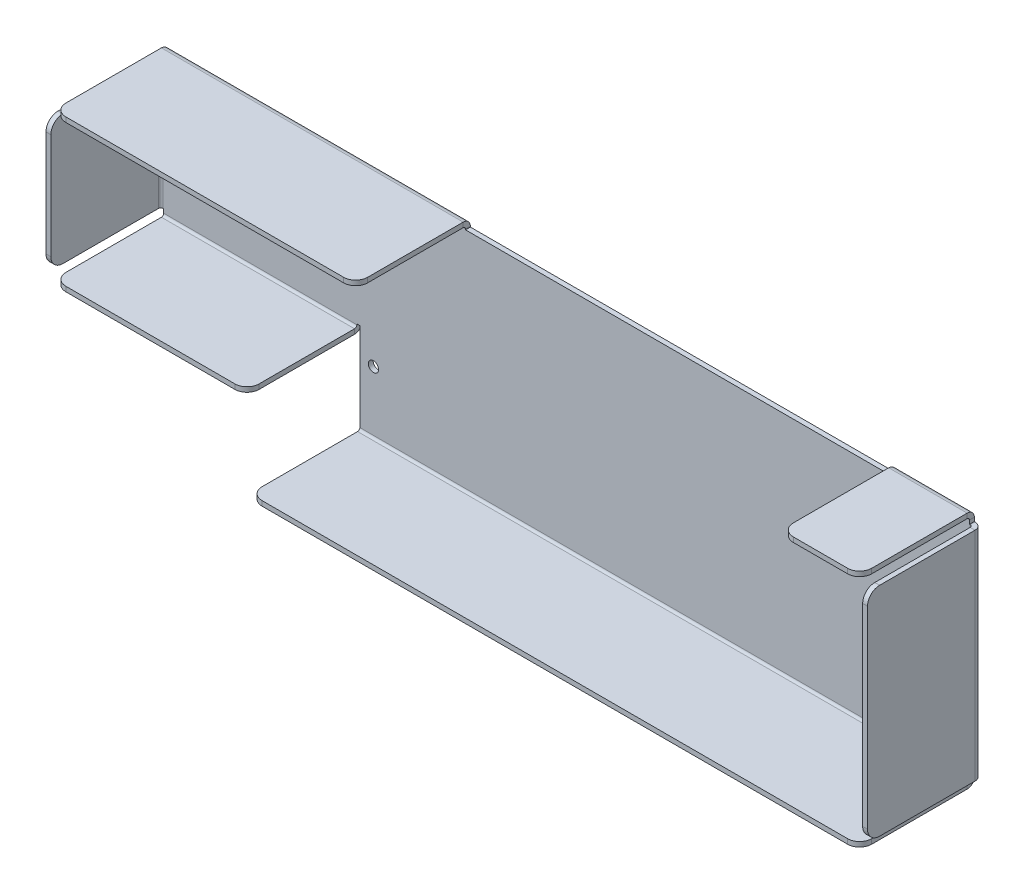
from build123d import *

# Parameters (mm, degrees)
SKETCH1_W              = 202
SKETCH1_H              = 74
BOSS_EXTRUDE1_DEPTH    = 1.6002
M3_CLEARANCE_HOLE1_D   = 3.4
SKETCH3_W              = 202
SKETCH3_H              = 2.5875
BOSS_EXTRUDE2_DEPTH    = 38
SKETCH6_W              = 35
SKETCH6_H              = 2.5875
SKETCH6_W_2            = 26
BOSS_EXTRUDE3_DEPTH    = 38
SKETCH7_W              = 2.5875
SKETCH7_H              = 72
BOSS_EXTRUDE4_DEPTH    = 38
SKETCH8_W              = 65
SKETCH8_H              = 45
BOSS_EXTRUDE5_DEPTH    = 1.6002
SKETCH9_W              = 65
SKETCH9_H              = 38
BOSS_EXTRUDE6_DEPTH    = 2.5875
SKETCH10_W             = 2.5875
SKETCH10_H             = 43
SKETCH10_W_2           = 64
SKETCH10_H_2           = 2.5875
BOSS_EXTRUDE7_DEPTH    = 38
CUT_EXTRUDE1_DEPTH     = 36.3998
CONVERT_SOLID1_START   = -101
CONVERT_SOLID1_DEPTH   = 202
CONVERT_SOLID1_START_2 = -166
CONVERT_SOLID1_2_DEPTH = 64
CONVERT_SOLID1_START_3 = -102
CONVERT_SOLID1_3_DEPTH = 36
CONVERT_SOLID1_START_4 = 75
CONVERT_SOLID1_4_DEPTH = 26
CONVERT_SOLID1_START_5 = -7
CONVERT_SOLID1_5_DEPTH = 43
CONVERT_SOLID1_START_6 = -36
CONVERT_SOLID1_6_DEPTH = 29
CONVERT_SOLID1_7_DEPTH = 267
CONVERT_SOLID1_8_DEPTH = 64
CONVERT_SOLID1_9_DEPTH = 72
FILLET1_R              = 4


# Read off the part's stored shape, not the designer's step: Convert-Solid1
with BuildPart() as part:
    # Sketch1 → Boss-Extrude1 (new body)
    with BuildSketch(Plane.XY):
        Rectangle(SKETCH1_W, SKETCH1_H)
    extrude(amount=BOSS_EXTRUDE1_DEPTH)

    # M3 Clearance Hole1 (through all)
    with Locations(Plane.XY.offset(1.6002)):
        with Locations((-96.5, 17.5), (95.5, -17.5), (-96.5, -17.5), (95.5, 17.5)):
            Hole(M3_CLEARANCE_HOLE1_D / 2)

    # Sketch3 → Boss-Extrude2 (add)
    with BuildSketch(Plane.XY):
        with Locations((0, -38.29375)):
            Rectangle(SKETCH3_W, SKETCH3_H)
    extrude(amount=BOSS_EXTRUDE2_DEPTH)

    # Sketch6 → Boss-Extrude3 (add)
    with BuildSketch(Plane.XY):
        with Locations((-83.5, 38.29375)):
            Rectangle(SKETCH6_W, SKETCH6_H)
        with Locations((88, 38.29375)):
            Rectangle(SKETCH6_W_2, SKETCH6_H)
    extrude(amount=BOSS_EXTRUDE3_DEPTH)

    # Sketch7 → Boss-Extrude4 (add)
    with BuildSketch(Plane.XY):
        with Locations((102.29375, 0)):
            Rectangle(SKETCH7_W, SKETCH7_H)
    extrude(amount=BOSS_EXTRUDE4_DEPTH)

    # Sketch8 → Boss-Extrude5 (add)
    with BuildSketch(Plane.XY):
        with Locations((-133.5, 14.5)):
            Rectangle(SKETCH8_W, SKETCH8_H)
    extrude(amount=BOSS_EXTRUDE5_DEPTH)

    # Sketch9 → Boss-Extrude6 (add)
    with BuildSketch(Plane(origin=(0, 37, 0), x_dir=(1, 0, 0), z_dir=(0, 1, 0))):
        with Locations((-133.5, -19)):
            Rectangle(SKETCH9_W, SKETCH9_H)
    extrude(amount=BOSS_EXTRUDE6_DEPTH)

    # Sketch10 → Boss-Extrude7 (add)
    with BuildSketch(Plane.XY):
        with Locations((-167.29375, 14.5)):
            Rectangle(SKETCH10_W, SKETCH10_H)
        with Locations((-134, -9.29375)):
            Rectangle(SKETCH10_W_2, SKETCH10_H_2)
    extrude(amount=BOSS_EXTRUDE7_DEPTH)

    # Sketch15 → Cut-Extrude1 (cut)
    with BuildSketch(Plane.XY.offset(38)):
        Polygon((102, 38), (-167, 38), (-167, -9), (-102, -9), (-102, -38), (102, -38), align=None)
    extrude(amount=-CUT_EXTRUDE1_DEPTH, mode=Mode.SUBTRACT)

    # Convert-Solid1 outline → Convert-Solid1 (add)
    with BuildSketch(Plane.YZ.offset(CONVERT_SOLID1_START)):
        with BuildLine():
            Line((-38, 1.6002), (-37.238, 1.6002))
            ThreePointArc((-37.238, 1.6002), (-37.776815367, 1.823384633), (-38, 2.3622))
            Line((-38, 2.3622), (-38, 1.6002))
        make_face()
        with BuildLine():
            Line((-39.5875, 2.117580723), (-39.5875, 38))
            Line((-39.5875, 38), (-39.6002, 38))
            Line((-39.6002, 38), (-39.6002, 2.3622))
            ThreePointArc((-39.6002, 2.3622), (-39.597022863, 2.239725635), (-39.5875, 2.117580723))
        make_face()
    extrude(amount=CONVERT_SOLID1_DEPTH)

    # Convert-Solid1 2 outline → Convert-Solid1 2 (add)
    with BuildSketch(Plane.YZ.offset(CONVERT_SOLID1_START_2)):
        with BuildLine():
            ThreePointArc((-10.6002, 2.3622), (-10.597022863, 2.239725635), (-10.5875, 2.117580723))
            Line((-10.5875, 2.117580723), (-10.5875, 38))
            Line((-10.5875, 38), (-10.6002, 38))
            Line((-10.6002, 38), (-10.6002, 2.3622))
        make_face()
        with BuildLine():
            Line((-9, 2.3622), (-9, 1.6002))
            Line((-9, 1.6002), (-8.238, 1.6002))
            ThreePointArc((-8.238, 1.6002), (-8.776815367, 1.823384633), (-9, 2.3622))
        make_face()
        with BuildLine():
            ThreePointArc((38, 2.3622), (37.776815367, 1.823384633), (37.238, 1.6002))
            Line((37.238, 1.6002), (38, 1.6002))
            Line((38, 1.6002), (38, 2.3622))
        make_face()
        with BuildLine():
            Line((39.5875, 38), (39.5875, 2.117580723))
            ThreePointArc((39.5875, 2.117580723), (39.597022863, 2.239725635), (39.6002, 2.3622))
            Line((39.6002, 2.3622), (39.6002, 38))
            Line((39.6002, 38), (39.5875, 38))
        make_face()
    extrude(amount=CONVERT_SOLID1_2_DEPTH)

    # Convert-Solid1 3 outline → Convert-Solid1 3 (add)
    with BuildSketch(Plane.YZ.offset(CONVERT_SOLID1_START_3)):
        with BuildLine():
            ThreePointArc((38, 2.3622), (37.776815367, 1.823384633), (37.238, 1.6002))
            Line((37.238, 1.6002), (38, 1.6002))
            Line((38, 1.6002), (38, 2.3622))
        make_face()
        with BuildLine():
            Line((39.5875, 38), (39.5875, 2.117580723))
            ThreePointArc((39.5875, 2.117580723), (39.597022863, 2.239725635), (39.6002, 2.3622))
            Line((39.6002, 2.3622), (39.6002, 38))
            Line((39.6002, 38), (39.5875, 38))
        make_face()
    extrude(amount=CONVERT_SOLID1_3_DEPTH)

    # Convert-Solid1 4 outline → Convert-Solid1 4 (add)
    with BuildSketch(Plane.YZ.offset(CONVERT_SOLID1_START_4)):
        with BuildLine():
            ThreePointArc((38, 2.3622), (37.776815367, 1.823384633), (37.238, 1.6002))
            Line((37.238, 1.6002), (38, 1.6002))
            Line((38, 1.6002), (38, 2.3622))
        make_face()
        with BuildLine():
            Line((39.5875, 38), (39.5875, 2.117580723))
            ThreePointArc((39.5875, 2.117580723), (39.597022863, 2.239725635), (39.6002, 2.3622))
            Line((39.6002, 2.3622), (39.6002, 38))
            Line((39.6002, 38), (39.5875, 38))
        make_face()
    extrude(amount=CONVERT_SOLID1_4_DEPTH)

    # Convert-Solid1 5 outline → Convert-Solid1 5 (add)
    with BuildSketch(Plane(origin=(0, 0, 0), x_dir=(1, 0, 0), z_dir=(0, 1, 0)).offset(CONVERT_SOLID1_START_5)):
        with BuildLine():
            ThreePointArc((-167, -2.3622), (-166.776815367, -1.823384633), (-166.238, -1.6002))
            Line((-166.238, -1.6002), (-167, -1.6002))
            Line((-167, -1.6002), (-167, -2.3622))
        make_face()
        with BuildLine():
            Line((102, -1.6002), (101.238, -1.6002))
            ThreePointArc((101.238, -1.6002), (101.776815367, -1.823384633), (102, -2.3622))
            Line((102, -2.3622), (102, -1.6002))
        make_face()
        with BuildLine():
            Line((-168.6002, -38), (-168.5875, -38))
            Line((-168.5875, -38), (-168.5875, -2.117580723))
            ThreePointArc((-168.5875, -2.117580723), (-168.597022863, -2.239725635), (-168.6002, -2.3622))
            Line((-168.6002, -2.3622), (-168.6002, -38))
        make_face()
        with BuildLine():
            Line((103.5875, -2.117580723), (103.5875, -38))
            Line((103.5875, -38), (103.6002, -38))
            Line((103.6002, -38), (103.6002, -2.3622))
            ThreePointArc((103.6002, -2.3622), (103.597022863, -2.239725635), (103.5875, -2.117580723))
        make_face()
    extrude(amount=CONVERT_SOLID1_5_DEPTH)

    # Convert-Solid1 6 outline → Convert-Solid1 6 (add)
    with BuildSketch(Plane(origin=(0, 0, 0), x_dir=(1, 0, 0), z_dir=(0, 1, 0)).offset(CONVERT_SOLID1_START_6)):
        with BuildLine():
            Line((102, -1.6002), (101.238, -1.6002))
            ThreePointArc((101.238, -1.6002), (101.776815367, -1.823384633), (102, -2.3622))
            Line((102, -2.3622), (102, -1.6002))
        make_face()
        with BuildLine():
            Line((103.5875, -2.117580723), (103.5875, -38))
            Line((103.5875, -38), (103.6002, -38))
            Line((103.6002, -38), (103.6002, -2.3622))
            ThreePointArc((103.6002, -2.3622), (103.597022863, -2.239725635), (103.5875, -2.117580723))
        make_face()
    extrude(amount=CONVERT_SOLID1_6_DEPTH)

    # Convert-Solid1 7 outline → Convert-Solid1 7 (cut)
    with BuildSketch(Plane.YZ.offset(CONVERT_SOLID1_START_2)):
        with BuildLine():
            Line((-10.5875, 2.117580723), (-10.5875, 1.6002))
            Line((-10.5875, 1.6002), (-10.473921475, 1.6002))
            ThreePointArc((-10.473921475, 1.6002), (-10.545258813, 1.855696681), (-10.5875, 2.117580723))
        make_face()
        with BuildLine():
            Line((-39.5875, 0), (-37.238, 0))
            ThreePointArc((-37.238, 0), (-38.81947861, 0.607516482), (-39.5875, 2.117580723))
            Line((-39.5875, 2.117580723), (-39.5875, 0))
        make_face()
        with BuildLine():
            ThreePointArc((39.5875, 2.117580723), (38.81947861, 0.607516482), (37.238, 0))
            Line((37.238, 0), (39.5875, 0))
            Line((39.5875, 0), (39.5875, 2.117580723))
        make_face()
    extrude(amount=CONVERT_SOLID1_7_DEPTH, mode=Mode.SUBTRACT)

    # Convert-Solid1 8 outline → Convert-Solid1 8 (cut)
    with BuildSketch(Plane.YZ.offset(CONVERT_SOLID1_START_2)):
        with BuildLine():
            Line((-10.473921475, 1.6002), (-10.5875, 1.6002))
            Line((-10.5875, 1.6002), (-10.5875, 0))
            Line((-10.5875, 0), (-8.238, 0))
            ThreePointArc((-8.238, 0), (-9.612771334, 0.441264649), (-10.473921475, 1.6002))
        make_face()
    extrude(amount=CONVERT_SOLID1_8_DEPTH, mode=Mode.SUBTRACT)

    # Convert-Solid1 9 outline → Convert-Solid1 9 (cut)
    with BuildSketch(Plane(origin=(0, 0, 0), x_dir=(1, 0, 0), z_dir=(0, 1, 0)).offset(CONVERT_SOLID1_START_6)):
        with BuildLine():
            Line((-168.5875, 0), (-168.5875, -2.117580723))
            ThreePointArc((-168.5875, -2.117580723), (-167.81947861, -0.607516482), (-166.238, 0))
            Line((-166.238, 0), (-168.5875, 0))
        make_face()
        with BuildLine():
            ThreePointArc((101.238, 0), (102.81947861, -0.607516482), (103.5875, -2.117580723))
            Line((103.5875, -2.117580723), (103.5875, 0))
            Line((103.5875, 0), (101.238, 0))
        make_face()
    extrude(amount=CONVERT_SOLID1_9_DEPTH, mode=Mode.SUBTRACT)

    # Fillet1
    fillet1_edges = [part.edges().sort_by_distance(p)[0] for p in [
        (75, 38.8001, 38),
        (101, 38.8001, 38),
        (102.8001, 36, 38),
        (102.8001, -36, 38),
        (101, -38.8001, 38),
        (-101, -38.8001, 38),
        (-102, -9.8001, 38),
        (-166, -9.8001, 38),
        (-167.8001, -7, 38),
        (-167.8001, 36, 38),
        (-166, 38.8001, 38),
        (-66, 38.8001, 38),
    ]]
    fillet(fillet1_edges, radius=FILLET1_R)


solid = part.part
